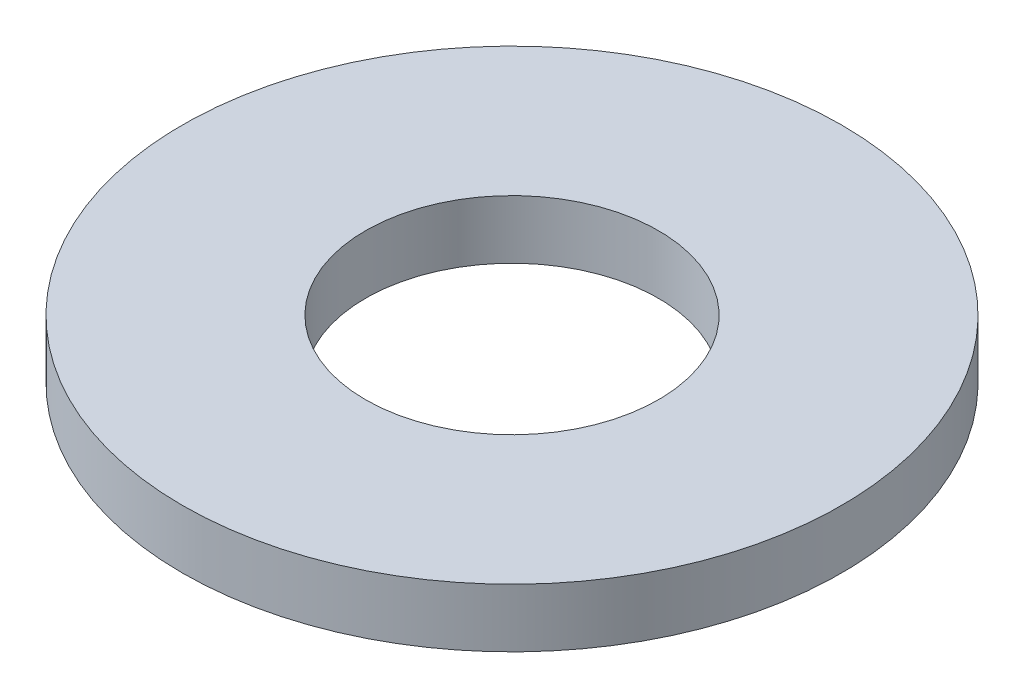
from build123d import *

# Parameters (mm, degrees)
SKETCH1_R           = 22.5
BOSS_EXTRUDE1_DEPTH = 4
SKETCH2_R           = 10
CUT_EXTRUDE1_DEPTH  = 33.070235422


with BuildPart() as part:
    # Sketch1 → Boss-Extrude1 (new body)
    with BuildSketch(Plane(origin=(0, 0, 0), x_dir=(1, 0, 0), z_dir=(0, 1, 0))):
        Circle(SKETCH1_R)
    extrude(amount=BOSS_EXTRUDE1_DEPTH)

    # Sketch2 → Cut-Extrude1 (cut, through all)
    with BuildSketch(Plane(origin=(0, 0, 0), x_dir=(1, 0, 0), z_dir=(0, 1, 0))):
        Circle(SKETCH2_R)
    extrude(amount=CUT_EXTRUDE1_DEPTH, mode=Mode.SUBTRACT)


solid = part.part
